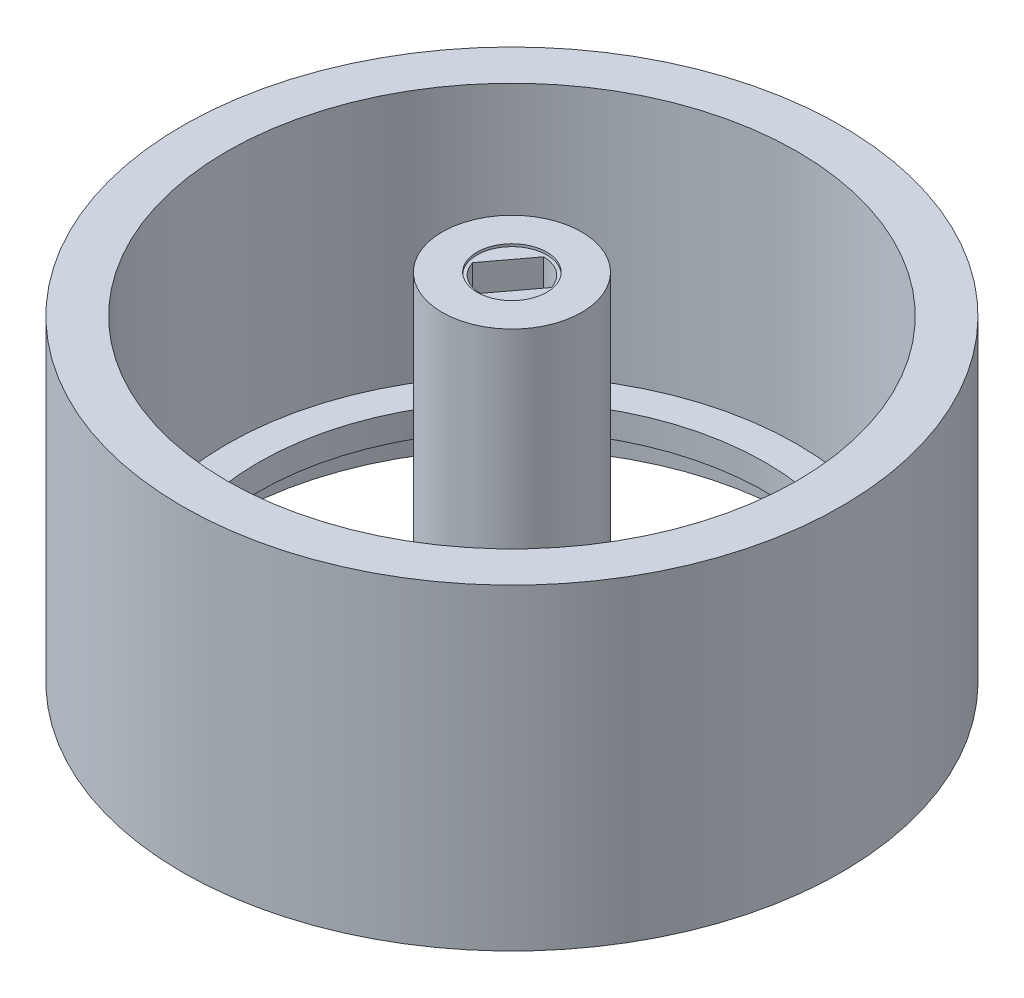
from build123d import *

# Parameters (mm, degrees)
SKETCH1_R           = 26
SKETCH1_R_2         = 22.5
BOSS_EXTRUDE1_DEPTH = 25
BOSS_EXTRUDE2_START = -2
SKETCH3_R           = 22.5
SKETCH3_R_2         = 20
BOSS_EXTRUDE2_DEPTH = 2
BOSS_EXTRUDE3_START = 2
SKETCH4_R           = 2.5
BOSS_EXTRUDE3_DEPTH = 2
SKETCH5_R           = 5.5
BOSS_EXTRUDE4_DEPTH = 25
CUT_EXTRUDE1_DEPTH  = 20
SKETCH7_R           = 9
CUT_EXTRUDE2_DEPTH  = 1
FILLET5_R           = 5
SKETCH8_R           = 5.011357572
BOSS_EXTRUDE5_DEPTH = 2
FILLET6_R           = 1
SKETCH9_R           = 2.75
CUT_EXTRUDE3_DEPTH  = 0.2


with BuildPart() as part:
    # Sketch1 → Boss-Extrude1 (new body)
    with BuildSketch(Plane(origin=(0, 0, 0), x_dir=(1, 0, 0), z_dir=(0, 1, 0))):
        with Locations(Location((0, 0, 0), (0, 0, 270))):
            Circle(SKETCH1_R)
        with Locations(Location((0, 0, 0), (0, 0, 270))):
            Circle(SKETCH1_R_2, mode=Mode.SUBTRACT)
    extrude(amount=BOSS_EXTRUDE1_DEPTH)

    # Sketch3 → Boss-Extrude2 (add)
    with BuildSketch(Plane(origin=(0, 5, 0), x_dir=(1, 0, 0), z_dir=(0, 1, 0)).offset(BOSS_EXTRUDE2_START)):
        with Locations(Location((0, 0, 0), (0, 0, 270))):
            Circle(SKETCH3_R)
        with Locations(Location((0, 0, 0), (0, 0, 270))):
            Circle(SKETCH3_R_2, mode=Mode.SUBTRACT)
    extrude(amount=BOSS_EXTRUDE2_DEPTH)

    # Sketch4 → Boss-Extrude3 (add)
    with BuildSketch(Plane.XZ.offset(-3).offset(BOSS_EXTRUDE3_START)):
        with BuildLine():
            ThreePointArc((8.678433718, -20.758968862), (11.368893562, -19.41644301), (13.85632013, -17.727165381))
            add(Edge.make_bspline(
                [(13.85632013, -17.727165381), (12.295332772, -13.841569941), (10.734345415, -9.955974501), (9.173358058, -6.070379061), (9.017640236, -5.682767684), (8.706204592, -4.907544931), (9.510436229, -3.072197276), (10.29132151, -2.775244997), (10.681764151, -2.626768858), (14.596088137, -1.138243647), (18.510412124, 0.350281564), (22.424736111, 1.838806775)],
                knots=[0, 0, 0, 0, 0.25002021, 0.25002021, 0.25002021, 0.27496122, 0.299902231, 0.324843242, 0.324843242, 0.324843242, 0.574885595, 0.574885595, 0.574885595, 0.574885595], degree=3))
            ThreePointArc((22.424736111, 1.838806775), (21.979315966, 4.812449445), (21.141374551, 7.700148186))
            add(Edge.make_bspline(
                [(21.141374551, 7.700148186), (16.963582067, 7.416276013), (12.785789582, 7.132403839), (8.607997098, 6.848531665), (8.191237319, 6.820213718), (7.357717761, 6.763577825), (5.860719657, 8.09560118), (5.81960808, 8.930030516), (5.799052291, 9.347245184), (5.592973323, 13.529968105), (5.386894355, 17.712691026), (5.180815387, 21.895413947)],
                knots=[0, 0, 0, 0, 0.25002021, 0.25002021, 0.25002021, 0.27496122, 0.299902231, 0.324843242, 0.324843242, 0.324843242, 0.574885595, 0.574885595, 0.574885595, 0.574885595], degree=3))
            ThreePointArc((5.180815387, 21.895413947), (2.215070754, 22.390700336), (-0.790232088, 22.486118679))
            add(Edge.make_bspline(
                [(-0.790232088, 22.486118679), (-1.811262484, 18.425080587), (-2.83229288, 14.364042495), (-3.853323276, 10.303004403), (-3.955177163, 9.897891573), (-4.158884936, 9.087665912), (-5.888312283, 8.075553965), (-6.694605915, 8.294307376), (-7.097752732, 8.403684082), (-11.139440525, 9.500223802), (-15.181128319, 10.596763522), (-19.222816112, 11.693303242)],
                knots=[0, 0, 0, 0, 0.25002021, 0.25002021, 0.25002021, 0.27496122, 0.299902231, 0.324843242, 0.324843242, 0.324843242, 0.574885595, 0.574885595, 0.574885595, 0.574885595], degree=3))
            ThreePointArc((-19.222816112, 11.693303242), (-20.610326953, 9.025764395), (-21.629764841, 6.197037432))
            add(Edge.make_bspline(
                [(-17.061169104, -14.668555103), (-14.769347644, -11.163530998), (-12.477526184, -7.658506894), (-10.185704723, -4.15348279), (-9.957102077, -3.803866644), (-9.499896784, -3.104634352), (-9.928050007, -1.147091413), (-10.635671237, -0.702980309), (-10.989481852, -0.480924757), (-14.536242848, 1.745062639), (-18.083003844, 3.971050036), (-21.629764841, 6.197037432)],
                knots=[0, 0, 0, 0, 0.250042353, 0.250042353, 0.250042353, 0.274983364, 0.299924375, 0.324865386, 0.324865386, 0.324865386, 0.574885595, 0.574885595, 0.574885595, 0.574885595], degree=3))
            ThreePointArc((-17.061169104, -14.668555103), (-14.95295333, -16.812471166), (-12.577697752, -18.656138916))
            add(Edge.make_bspline(
                [(8.678433718, -20.758968862), (6.053169483, -17.496205114), (3.427905248, -14.233441366), (0.802641014, -10.970677618), (0.540778402, -10.645226251), (0.01705318, -9.994323517), (-1.97698741, -9.796607394), (-2.618029155, -10.332357297), (-2.938550027, -10.600232249), (-6.151599269, -13.285534472), (-9.36464851, -15.970836694), (-12.577697752, -18.656138916)],
                knots=[0, 0, 0, 0, 0.250042353, 0.250042353, 0.250042353, 0.274983364, 0.299924375, 0.324865386, 0.324865386, 0.324865386, 0.574885595, 0.574885595, 0.574885595, 0.574885595], degree=3))
        make_face()
        with Locations(Location((0, 0.491696266, 0), (0, 0, 270))):
            Circle(SKETCH4_R, mode=Mode.SUBTRACT)
    extrude(amount=-BOSS_EXTRUDE3_DEPTH)

    # Sketch7 → Cut-Extrude2 (cut)
    with BuildSketch(Plane.XZ.offset(-1)):
        with Locations(Location((0, 0, 0), (0, 0, 270))):
            Circle(SKETCH7_R)
    extrude(amount=-CUT_EXTRUDE2_DEPTH, mode=Mode.SUBTRACT)

    # Fillet5
    # the kernel refuses this fillet: 5 mm, written as the material it takes off along each edge
    with BuildSketch(Plane(origin=(0, 1, 0), x_dir=(0, 0, -1), z_dir=(-1, 0, 0))) as fillet5_piece_1:
        with BuildLine():
            CenterArc((12, -5), FILLET5_R, 90, 36.869897646)
            Line((9, -1), (8.94, -0.92))
            ThreePointArc((8.94, -0.92), (8.9, -0.5), (8.9, 0))
            Line((8.9, 0), (9, 0.1))
            Line((9, 0.1), (12, 0.1))
            Line((12, 0.1), (12, 0))
        make_face()
    revolve(axis=Axis((0, 1, 0), (0, -1, 0)), mode=Mode.SUBTRACT)

    # Sketch8 → Boss-Extrude5 (add)
    with BuildSketch(Plane.XZ.offset(-2)):
        with Locations(Location((0, 0, 0), (0, 0, 270))):
            Circle(SKETCH8_R)
    extrude(amount=BOSS_EXTRUDE5_DEPTH)

    # Fillet6
    fillet6_edges = [part.edges().sort_by_distance(p)[0] for p in [
        (0, 0, 5.011357572),
    ]]
    fillet(fillet6_edges, radius=FILLET6_R)


with BuildPart() as body_2:
    # Sketch5 → Boss-Extrude4 (new body)
    with BuildSketch(Plane(origin=(0, 3, 0), x_dir=(1, 0, 0), z_dir=(0, 1, 0))):
        with Locations(Location((0, 0, 0), (0, 0, 270))):
            Circle(SKETCH5_R)
    extrude(amount=BOSS_EXTRUDE4_DEPTH)

    # Sketch6 → Cut-Extrude1 (cut)
    with BuildSketch(Plane(origin=(0, 28, 0), x_dir=(1, 0, 0), z_dir=(0, 1, 0))):
        with BuildLine():
            Line((-2.4, -0.7), (0, 2.5))
            ThreePointArc((0, 2.5), (1.5, 2), (2.4, 0.7))
            Line((2.4, 0.7), (0, -2.5))
            ThreePointArc((0, -2.5), (-1.5, -2), (-2.4, -0.7))
        make_face()
    extrude(amount=-CUT_EXTRUDE1_DEPTH, mode=Mode.SUBTRACT)

    # Sketch9 → Cut-Extrude3 (cut)
    with BuildSketch(Plane(origin=(0, 28, 0), x_dir=(1, 0, 0), z_dir=(0, 1, 0))):
        with Locations(Location((0, 0, 0), (0, 0, 270))):
            Circle(SKETCH9_R)
    extrude(amount=-CUT_EXTRUDE3_DEPTH, mode=Mode.SUBTRACT)


solid = Compound([part.part, body_2.part])
